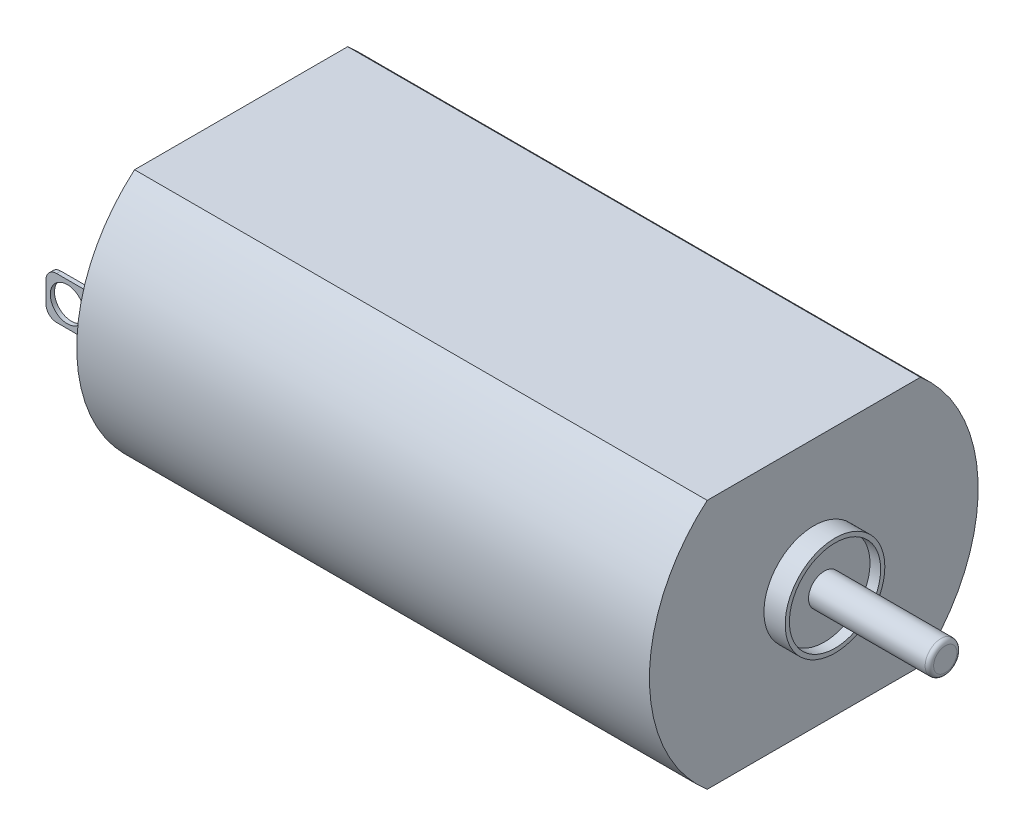
from build123d import *

# Parameters (mm, degrees)
EXTRUDE_1_DEPTH     = 26.8
EXTRUDE_START       = -0.2
EXTRUDE_1_2_DEPTH   = 0.2
SKETCH_2_R          = 4.35
EXTRUDE_2_DEPTH     = 0.2
FILLET_1_R          = 2
SKETCH_3_R          = 2.3
EXTRUDE_3_DEPTH     = 1.8
FILLET_2_R          = 1
SKETCH_4_W          = 1.8
SKETCH_4_H          = 3.7
EXTRUDE_8_DEPTH     = 0.3
SKETCH_4_4_W        = 0.2
SKETCH_4_4_H        = 2
EXTRUDE_9_DEPTH     = 3.2
CUT_EXTRUDE_1_REACH = 32.784
SKETCH_5_R          = 0.8
CUT_EXTRUDE_2_REACH = 32.784
SKETCH_6_R          = 0.8
FILLET_3_R          = 0.5
SKETCH_7_R          = 0.9
EXTRUDE_10_DEPTH    = 0.2
SKETCH_8_R          = 2.35
SKETCH_8_R_2        = 2.15
EXTRUDE_2_2_DEPTH   = 1
SKETCH_8_2_R        = 2.35
EXTRUDE_11_DEPTH    = 0.5
SKETCH_9_R          = 0.75
EXTRUDE_12_DEPTH    = 6.2
FILLET_4_R          = 0.2


# Read off the part's stored shape, not the designer's step: 拉伸-薄壁1
with BuildPart() as part:
    # 草图1 → Extrude 1 (new body)
    with BuildSketch(Plane(origin=(0, 0, 0), x_dir=(0, 0, -1), z_dir=(1, 0, 0))):
        with BuildLine():
            ThreePointArc((-7.75, 0), (-7.035897095, -3.249407956), (-5.025186564, -5.9))
            Line((-5.025186564, -5.9), (5.025186564, -5.9))
            ThreePointArc((5.025186564, -5.9), (7.035897095, -3.249407956), (7.75, 0))
            ThreePointArc((7.75, 0), (7.035897095, 3.249407956), (5.025186564, 5.9))
            Line((5.025186564, 5.9), (-5.025186564, 5.9))
            ThreePointArc((-5.025186564, 5.9), (-7.035897095, 3.249407956), (-7.75, 0))
        make_face()
    extrude(amount=EXTRUDE_1_DEPTH)



with BuildPart() as body_2:
    # Extrude 1 2 outline → Extrude 1 2 (new body)
    with BuildSketch(Plane(origin=(0, 0, 0), x_dir=(0, 0, -1), z_dir=(1, 0, 0)).offset(EXTRUDE_START)):
        with BuildLine():
            Line((5.025186564, 5.9), (-5.025186564, 5.9))
            ThreePointArc((-5.025186564, 5.9), (-7.75, 0), (-5.025186564, -5.9))
            Line((-5.025186564, -5.9), (5.025186564, -5.9))
            ThreePointArc((5.025186564, -5.9), (7.75, 0), (5.025186564, 5.9))
        make_face()
        with BuildLine():
            ThreePointArc((-4.988236161, -5.8), (-7.65, 0), (-4.988236161, 5.8))
            Line((-4.988236161, 5.8), (4.988236161, 5.8))
            ThreePointArc((4.988236161, 5.8), (7.65, 0), (4.988236161, -5.8))
            Line((4.988236161, -5.8), (-4.988236161, -5.8))
        make_face(mode=Mode.SUBTRACT)
    extrude(amount=EXTRUDE_1_2_DEPTH)


with BuildPart() as part_1:
    add(part.part)

    add(body_2.part)  # Extrude 2 merges body 2
    # 草图2 → Extrude 2 (add)
    with BuildSketch(Plane.ZY):
        Circle(SKETCH_2_R)
    extrude(amount=EXTRUDE_2_DEPTH)

    # 圆角1
    # the kernel refuses this fillet: 2 mm, written as the material it takes off along each edge
    with BuildSketch(Plane(origin=(-0.2, 0, 0), x_dir=(0, 0, 1), z_dir=(0, -1, 0))) as fillet_1_piece_1:
        with BuildLine():
            CenterArc((3.478220211, -2), FILLET_1_R, 64.158067237, 25.841932763)
            Line((3.478220211, 0), (3.478220211, 0.04))
            Line((3.478220211, 0.04), (4.35, 0.04))
            Line((4.35, 0.04), (4.39, 0))
            ThreePointArc((4.39, 0), (4.39, -0.1), (4.367435596, -0.164))
            Line((4.367435596, -0.164), (4.35, -0.2))
        make_face()
    revolve(axis=Axis((-0.2, 0, 0), (-1, 0, 0)), mode=Mode.SUBTRACT)

    # 草图3 → 凸台-拉伸3 (add)
    with BuildSketch(Plane.ZY.offset(0.2)):
        Circle(SKETCH_3_R)
    extrude(amount=EXTRUDE_3_DEPTH)

    # 圆角2
    fillet_2_edges = [part_1.edges().sort_by_distance(p)[0] for p in [
        (-2, 0, -2.3),
    ]]
    fillet(fillet_2_edges, radius=FILLET_2_R)

    # 草图4 → 凸台-拉伸8 (add)
    with BuildSketch(Plane.ZY):
        with Locations((-6.1, 0)):
            Rectangle(SKETCH_4_W, SKETCH_4_H)
        with Locations((6.1, 0)):
            Rectangle(SKETCH_4_W, SKETCH_4_H)
    extrude(amount=EXTRUDE_8_DEPTH)

    # 草图4<4> → 凸台-拉伸9 (add)
    with BuildSketch(Plane.ZY):
        with Locations((6.1, 0)):
            Rectangle(SKETCH_4_4_W, SKETCH_4_4_H)
        with Locations((-6.1, 0)):
            Rectangle(SKETCH_4_4_W, SKETCH_4_4_H)
    extrude(amount=EXTRUDE_9_DEPTH)

    # 草图5 → 切除-拉伸1 (cut, up to next)
    with BuildSketch(Plane(origin=(0, 0, -6.2), x_dir=(-1, 0, 0), z_dir=(0, 0, -1)), mode=Mode.PRIVATE) as cut_extrude_1_sk1:
        with Locations((2.2, 0)):
            Circle(SKETCH_5_R)
    cut_extrude_1_tool1 = extrude(cut_extrude_1_sk1.sketch, amount=-CUT_EXTRUDE_1_REACH, mode=Mode.PRIVATE) & part_1.part
    add(cut_extrude_1_tool1.solids().sort_by_distance((-2.2, 0, -6.2))[0], mode=Mode.SUBTRACT)

    # 草图6 → 切除-拉伸2 (cut, up to next)
    with BuildSketch(Plane.XY.offset(6.2), mode=Mode.PRIVATE) as cut_extrude_2_sk1:
        with Locations(Location((-2.2, 0, 0), (0, 0, 180))):
            Circle(SKETCH_6_R)
    cut_extrude_2_tool1 = extrude(cut_extrude_2_sk1.sketch, amount=-CUT_EXTRUDE_2_REACH, mode=Mode.PRIVATE) & part_1.part
    add(cut_extrude_2_tool1.solids().sort_by_distance((-2.2, 0, 6.2))[0], mode=Mode.SUBTRACT)

    # 圆角3
    fillet_3_edges = [part_1.edges().sort_by_distance(p)[0] for p in [
        (-3.2, -1, -6.1),
        (-3.2, 1, -6.1),
        (-3.2, 1, 6.1),
        (-3.2, -1, 6.1),
    ]]
    fillet(fillet_3_edges, radius=FILLET_3_R)

    # 草图7 → 凸台-拉伸10 (add)
    with BuildSketch(Plane.ZY):
        with Locations(Location((-4.7, 3.85, 0), (0, 0, 180))):
            Circle(SKETCH_7_R)
        with Locations(Location((4.7, 3.85, 0), (0, 0, 180))):
            Circle(SKETCH_7_R)
        with Locations(Location((4.7, -3.85, 0), (0, 0, 180))):
            Circle(SKETCH_7_R)
        with Locations(Location((-4.7, -3.85, 0), (0, 0, 180))):
            Circle(SKETCH_7_R)
    extrude(amount=EXTRUDE_10_DEPTH)

    # 草图8 → Extrude 2 2 (add)
    with BuildSketch(Plane(origin=(26.8, 0, 0), x_dir=(0, 0, -1), z_dir=(1, 0, 0))):
        Circle(SKETCH_8_R)
        Circle(SKETCH_8_R_2, mode=Mode.SUBTRACT)
    extrude(amount=EXTRUDE_2_2_DEPTH)

    # 草图8<2> → 凸台-拉伸11 (add)
    with BuildSketch(Plane(origin=(26.8, 0, 0), x_dir=(0, 0, -1), z_dir=(1, 0, 0))):
        Circle(SKETCH_8_2_R)
    extrude(amount=EXTRUDE_11_DEPTH)

    # 草图9 → 凸台-拉伸12 (add)
    with BuildSketch(Plane(origin=(26.8, 0, 0), x_dir=(0, 0, -1), z_dir=(1, 0, 0))):
        with Locations(Location((0, 0, 0), (0, 0, 180))):
            Circle(SKETCH_9_R)
    extrude(amount=EXTRUDE_12_DEPTH)

    # 圆角4
    fillet_4_edges = [part_1.edges().sort_by_distance(p)[0] for p in [
        (33, 0, -0.75),
    ]]
    fillet(fillet_4_edges, radius=FILLET_4_R)


solid = part_1.part
